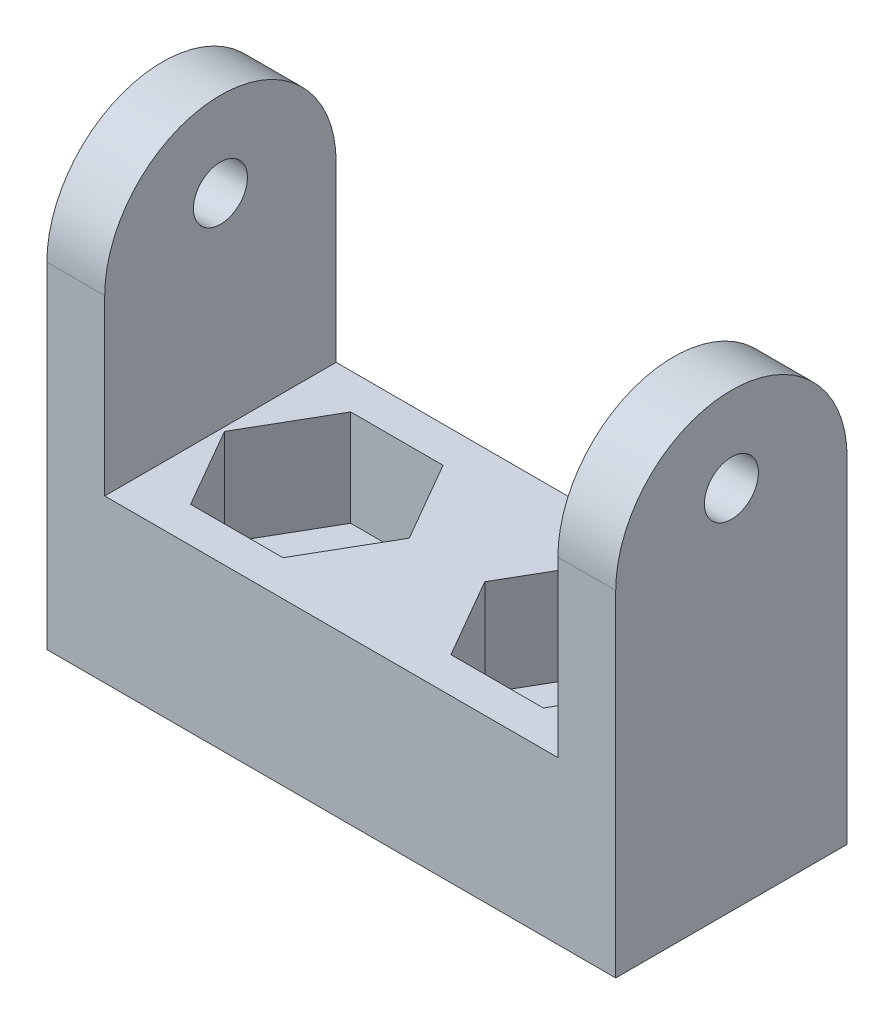
from build123d import *

# Parameters (mm, degrees)
SKETCH_1_W          = 29.5
SKETCH_1_H          = 12
EXTRUDE_1_DEPTH     = 23.4
SKETCH_3_W          = 23.5
SKETCH_3_H          = 12
CUT_EXTRUDE_1_DEPTH = 15
SKETCH_4_R          = 1.4
CUT_EXTRUDE_2_DEPTH = 39.12886046
FILLET_1_RADIUS     = 6
FILLET_1_LENGTH     = 3
MIRROR_START        = 11.75
MIRROR_1_DEPTH      = 3
HOLE_WIZARD_M5_1_D  = 5.3
CUT_EXTRUDE_4_DEPTH = 5


# Read off the part's stored shape, not the designer's step: 镜向1
with BuildPart() as part:
    # 草图1 → 凸台-拉伸1 (new body)
    with BuildSketch(Plane(origin=(0, 0, 0), x_dir=(1, 0, 0), z_dir=(0, 1, 0))):
        Rectangle(SKETCH_1_W, SKETCH_1_H)
    extrude(amount=EXTRUDE_1_DEPTH)

    # 草图3 → 切除-拉伸1 (cut)
    with BuildSketch(Plane(origin=(0, 23.4, 0), x_dir=(1, 0, 0), z_dir=(0, 1, 0))):
        Rectangle(SKETCH_3_W, SKETCH_3_H)
    extrude(amount=-CUT_EXTRUDE_1_DEPTH, mode=Mode.SUBTRACT)

    # 草图4 → 切除-拉伸2 (cut, through all)
    with BuildSketch(Plane.ZY.offset(14.75)):
        with Locations((0, 19)):
            Circle(SKETCH_4_R)
    extrude(amount=-CUT_EXTRUDE_2_DEPTH, mode=Mode.SUBTRACT)

    # 圆角1: full round fillet: the end face becomes a half cylinder, R = half its width
    fillet_1_face = Plane((-13.25, 23.4, 0), x_dir=(-1, 0, 0), z_dir=(0, 1, 0))  # on the end face: x along it, z out of the body
    fillet_1_slab = fillet_1_face.offset(-FILLET_1_RADIUS / 2) * Box(FILLET_1_LENGTH, 2 * FILLET_1_RADIUS, FILLET_1_RADIUS, mode=Mode.PRIVATE)  # the body's end, R deep
    fillet_1_round = Plane((-13.25, 17.4, 0), x_dir=(0, 1, 0), z_dir=(-1, 0, 0)) * Cylinder(FILLET_1_RADIUS, FILLET_1_LENGTH, mode=Mode.PRIVATE)  # its axis R under the face
    add(fillet_1_slab - fillet_1_round, mode=Mode.SUBTRACT)

    # 镜向1 outline → 镜向1 (cut)
    with BuildSketch(Plane.YZ.offset(MIRROR_START)):
        with BuildLine():
            Line((23.4, 6), (17.4, 6))
            ThreePointArc((17.4, 6), (21.642640687, 4.242640687), (23.4, 0))
            Line((23.4, 0), (23.4, 6))
        make_face()
        with BuildLine():
            Line((23.4, -6), (23.4, 0))
            ThreePointArc((23.4, 0), (21.642640687, -4.242640687), (17.4, -6))
            Line((17.4, -6), (23.4, -6))
        make_face()
    extrude(amount=MIRROR_1_DEPTH, mode=Mode.SUBTRACT)

    # M5 间隙孔1 (through all)
    with Locations(Plane(origin=(0, 0, 0), x_dir=(-1, 0, 0), z_dir=(0, -1, 0))):
        with Locations((-6.75, 0), (6.75, 0)):
            Hole(HOLE_WIZARD_M5_1_D / 2)

    # 草图10 → 切除-拉伸4 (cut)
    with BuildSketch(Plane.XZ.offset(-8.4)):
        Polygon((1.957992766, 0), (4.353996383, -4.15), (9.146003617, -4.15), (11.542007234, 0), (9.146003617, 4.15), (4.353996383, 4.15), align=None)
        Polygon((-11.542007234, 0), (-9.146003617, -4.15), (-4.353996383, -4.15), (-1.957992766, 0), (-4.353996383, 4.15), (-9.146003617, 4.15), align=None)
    extrude(amount=CUT_EXTRUDE_4_DEPTH, mode=Mode.SUBTRACT)


solid = part.part
